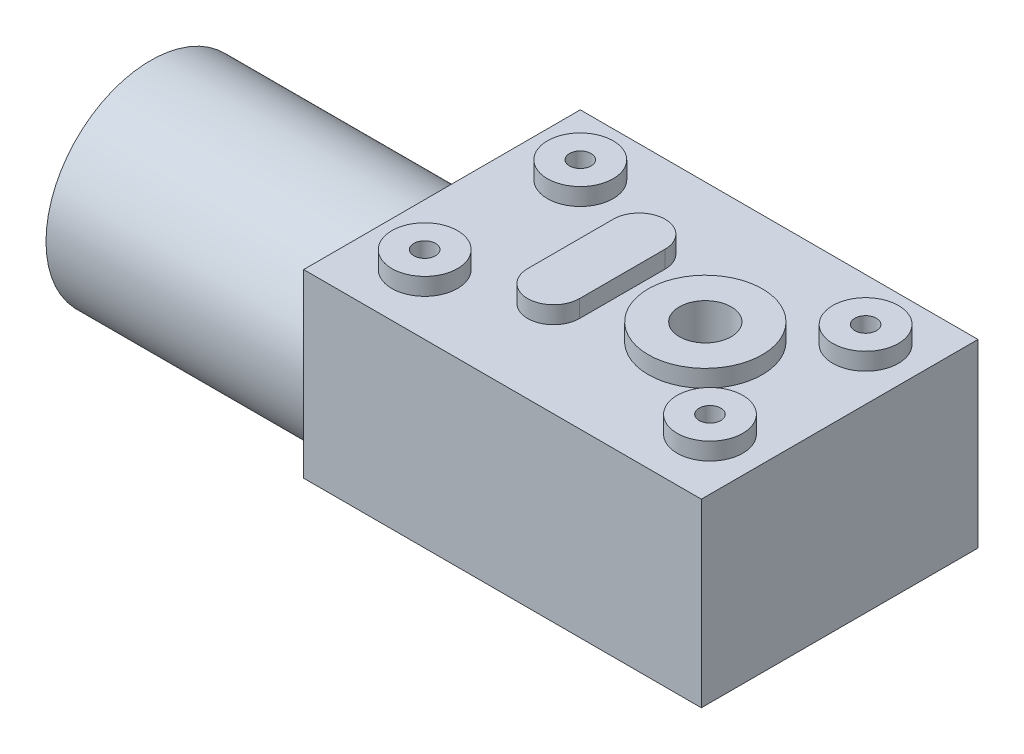
from build123d import *
from OCP.BRepFilletAPI import BRepFilletAPI_MakeChamfer

# Parameters (mm, degrees)
SKETCH1_W                       = 46
SKETCH1_H                       = 32
SKETCH1_R                       = 3
BOSS_EXTRUDE1_DEPTH             = 22.3
SKETCH3_R                       = 3.8
SKETCH3_R_2                     = 6.6
BOSS_EXTRUDE3_DEPTH             = 2
SKETCH4_R                       = 3
CUT_EXTRUDE1_DEPTH              = 36.809077062
SKETCH2_R                       = 12.1
BOSS_EXTRUDE2_DEPTH             = 30.8
CHAMFER1_SIZE                   = 1.4
CHAMFER1_SIZE2                  = 5.224871131
TAP_DRILL_FOR_M3X0_5_TAP1_D     = 2.5
TAP_DRILL_FOR_M3X0_5_TAP1_DEPTH = 2.6
TAP_DRILL_FOR_M3X0_5_TAP1_TIP   = 0.751075774
SKETCH8_R                       = 11.8
CUT_EXTRUDE2_DEPTH              = 0.8
SKETCH7_R                       = 3.2
BOSS_EXTRUDE5_DEPTH             = 2.7


with BuildPart() as part:
    # Sketch1 → Boss-Extrude1 (new body)
    with BuildSketch(Plane(origin=(0, 0, 0), x_dir=(1, 0, 0), z_dir=(0, 1, 0))):
        Rectangle(SKETCH1_W, SKETCH1_H)
        with Locations((7.460620525, 0)):
            Circle(SKETCH1_R, mode=Mode.SUBTRACT)
    extrude(amount=BOSS_EXTRUDE1_DEPTH)

    # Sketch3 → Boss-Extrude3 (add)
    with BuildSketch(Plane(origin=(0, 22.3, 0), x_dir=(1, 0, 0), z_dir=(0, 1, 0))):
        with Locations((-16, -9)):
            Circle(SKETCH3_R)
        with Locations((7.460620525, 0)):
            Circle(SKETCH3_R_2)
        with Locations((17, -9)):
            Circle(SKETCH3_R)
        with Locations((17, 9)):
            Circle(SKETCH3_R)
        with Locations((-16, 9)):
            Circle(SKETCH3_R)
        with BuildLine():
            Line((-8.139379475, -4.95), (-8.139379475, 4.95))
            ThreePointArc((-8.139379475, 4.95), (-5.139379475, 7.95), (-2.139379475, 4.95))
            Line((-2.139379475, 4.95), (-2.139379475, -4.95))
            ThreePointArc((-2.139379475, -4.95), (-5.139379475, -7.95), (-8.139379475, -4.95))
        make_face()
    extrude(amount=BOSS_EXTRUDE3_DEPTH)

    # Sketch4 → Cut-Extrude1 (cut, through all)
    with BuildSketch(Plane.XZ.offset(-22.3)):
        with Locations((7.460620525, 0)):
            Circle(SKETCH4_R)
    extrude(amount=-CUT_EXTRUDE1_DEPTH, mode=Mode.SUBTRACT)

    # Sketch2 → Boss-Extrude2 (add)
    with BuildSketch(Plane.ZY.offset(23)):
        with Locations((2.9, 9.2)):
            Circle(SKETCH2_R)
    extrude(amount=BOSS_EXTRUDE2_DEPTH)

    # Chamfer1: one chamfer whose edges measure the first distance from different faces: ONE call of the kernel's chamfer builder (chamfer() names one face for all edges)
    chamfer1_edges_1 = [part.edges().sort_by_distance(p)[0] for p in [
        (0, 0, 16),
    ]]
    chamfer1_side_1 = [part.faces().sort_by_distance(p)[0] for p in [
        (0, 11.15, 16),
    ]]
    chamfer1_edges_2 = [part.edges().sort_by_distance(p)[0] for p in [
        (23, 0, 0),
    ]]
    chamfer1_side_2 = [part.faces().sort_by_distance(p)[0] for p in [
        (23, 11.15, 0),
    ]]
    chamfer1_edges_3 = [part.edges().sort_by_distance(p)[0] for p in [
        (0, 0, -16),
    ]]
    chamfer1_side_3 = [part.faces().sort_by_distance(p)[0] for p in [
        (0, 11.15, -16),
    ]]
    chamfer1 = BRepFilletAPI_MakeChamfer(part.part.solid().wrapped)
    for e in chamfer1_edges_1:
        chamfer1.Add(CHAMFER1_SIZE, CHAMFER1_SIZE2, e.wrapped, chamfer1_side_1[0].wrapped)  # the first distance lies on this face
    for e in chamfer1_edges_2:
        chamfer1.Add(CHAMFER1_SIZE, CHAMFER1_SIZE2, e.wrapped, chamfer1_side_2[0].wrapped)  # the first distance lies on this face
    for e in chamfer1_edges_3:
        chamfer1.Add(CHAMFER1_SIZE, CHAMFER1_SIZE2, e.wrapped, chamfer1_side_3[0].wrapped)  # the first distance lies on this face
    add(Compound.cast(chamfer1.Shape()), mode=Mode.REPLACE)

    # Tap Drill for M3x0.5 Tap1
    with Locations(Plane(origin=(0, 24.3, 0), x_dir=(1, 0, 0), z_dir=(0, 1, 0))):
        with Locations((-16, -9), (-16, 9), (17, 9), (17, -9)):
            Hole(TAP_DRILL_FOR_M3X0_5_TAP1_D / 2, depth=TAP_DRILL_FOR_M3X0_5_TAP1_DEPTH)
            with Locations((0, 0, -(TAP_DRILL_FOR_M3X0_5_TAP1_DEPTH + TAP_DRILL_FOR_M3X0_5_TAP1_TIP / 2))):  # 118° drill point
                Cone(0, TAP_DRILL_FOR_M3X0_5_TAP1_D / 2, TAP_DRILL_FOR_M3X0_5_TAP1_TIP, mode=Mode.SUBTRACT)

    # Sketch8 → Cut-Extrude2 (cut)
    with BuildSketch(Plane.ZY.offset(53.8)):
        with Locations((2.9, 9.2)):
            Circle(SKETCH8_R)
    extrude(amount=-CUT_EXTRUDE2_DEPTH, mode=Mode.SUBTRACT)

    # Sketch7 → Boss-Extrude5 (add)
    with BuildSketch(Plane.ZY.offset(53)):
        with Locations((2.9, 9.2)):
            Circle(SKETCH7_R)
    extrude(amount=BOSS_EXTRUDE5_DEPTH)


solid = part.part
